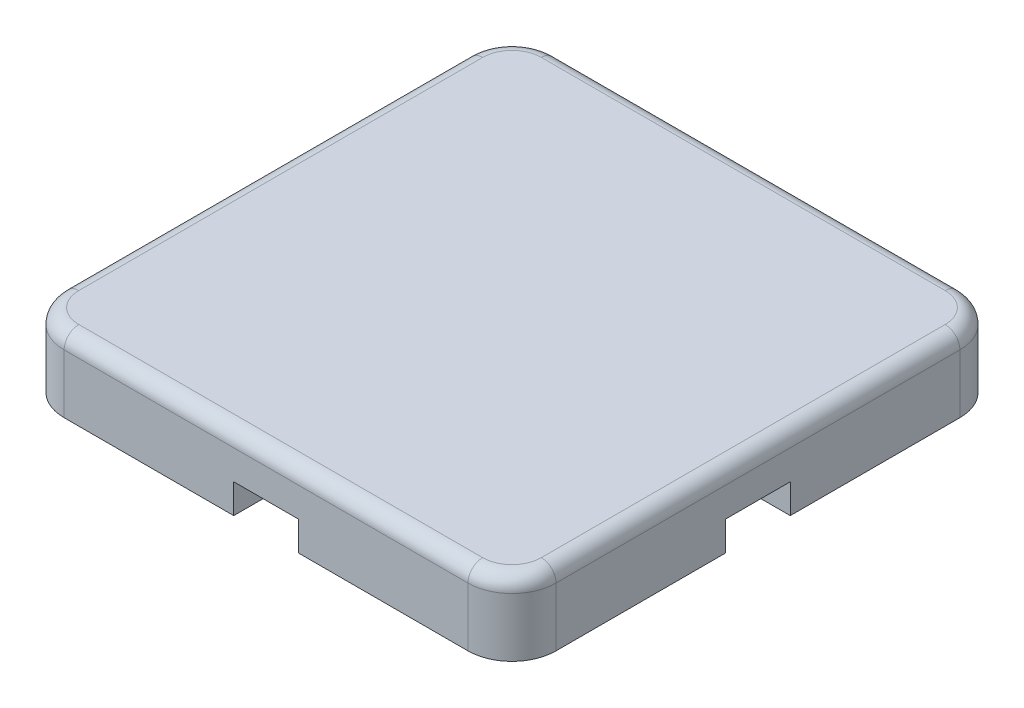
from build123d import *

# Parameters (mm, degrees)
BOSS_EXTRUDE1_DEPTH = 5
SHELL1_T            = -2
FILLET1_R           = 1
SKETCH2_R           = 8.5
BOSS_EXTRUDE2_DEPTH = 1.6
SKETCH3_W           = 4.4
SKETCH3_H           = 2
SKETCH3_W_2         = 2
SKETCH3_H_2         = 4.4
CUT_EXTRUDE1_DEPTH  = 2


with BuildPart() as part:
    # Sketch1 → Boss-Extrude1 (new body)
    with BuildSketch(Plane(origin=(0, 0, 0), x_dir=(1, 0, 0), z_dir=(0, 1, 0))):
        with BuildLine():
            Line((-13.75, -16.75), (13.75, -16.75))
            ThreePointArc((13.75, -16.75), (15.871320344, -15.871320344), (16.75, -13.75))
            Line((16.75, -13.75), (16.75, 13.75))
            ThreePointArc((16.75, 13.75), (15.871320344, 15.871320344), (13.75, 16.75))
            Line((13.75, 16.75), (-13.75, 16.75))
            ThreePointArc((-13.75, 16.75), (-15.871320344, 15.871320344), (-16.75, 13.75))
            Line((-16.75, 13.75), (-16.75, -13.75))
            ThreePointArc((-16.75, -13.75), (-15.871320344, -15.871320344), (-13.75, -16.75))
        make_face()
    extrude(amount=BOSS_EXTRUDE1_DEPTH)

    # Shell1
    shell1_openings = [part.faces().sort_by_distance(p)[0] for p in [
        (0, 0, 0),
    ]]
    offset(amount=SHELL1_T, openings=shell1_openings, kind=Kind.INTERSECTION)

    # Fillet1
    fillet1_edges = [part.edges().sort_by_distance(p)[0] for p in [
        (-16.75, 5, 0),
        (-15.871320344, 5, -15.871320344),
        (0, 5, -16.75),
        (15.871320344, 5, -15.871320344),
        (16.75, 5, 0),
        (15.871320344, 5, 15.871320344),
        (0, 5, 16.75),
        (-15.871320344, 5, 15.871320344),
    ]]
    fillet(fillet1_edges, radius=FILLET1_R)

    # Sketch2 → Boss-Extrude2 (add)
    with BuildSketch(Plane.XZ.offset(-3)):
        Circle(SKETCH2_R)
    extrude(amount=BOSS_EXTRUDE2_DEPTH)

    # Sketch3 → Cut-Extrude1 (cut)
    with BuildSketch(Plane.XZ):
        with Locations((0, 15.75)):
            Rectangle(SKETCH3_W, SKETCH3_H)
        with Locations((-15.75, 0)):
            Rectangle(SKETCH3_W_2, SKETCH3_H_2)
        with Locations((0, -15.75)):
            Rectangle(SKETCH3_W, SKETCH3_H)
        with Locations((15.75, 0)):
            Rectangle(SKETCH3_W_2, SKETCH3_H_2)
    extrude(amount=-CUT_EXTRUDE1_DEPTH, mode=Mode.SUBTRACT)


solid = part.part
